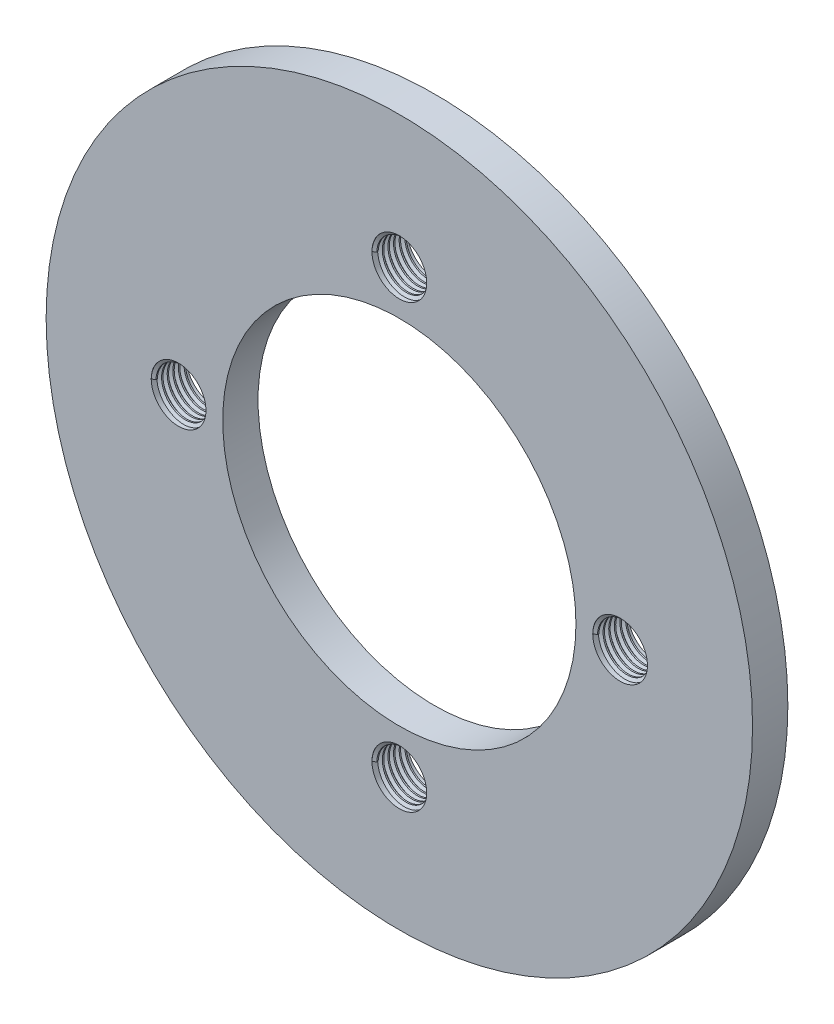
from build123d import *
from build123d.topology import SkipClean

# Parameters (mm, degrees)
SKETCH_1_R          = 20
SKETCH_1_R_2        = 10
EXTRUDE_1_DEPTH     = 2
SKETCH_2_R          = 1.55
CUT_EXTRUDE_1_DEPTH = 29.354893758
THREAD_1_PITCH      = 0.3175
THREAD_2_PITCH      = 0.3175
THREAD_3_PITCH      = 0.3175
THREAD_4_PITCH      = 0.3175


with BuildPart() as part:
    # Sketch 1 → 凸台-拉伸1 (new body)
    with BuildSketch(Plane.XY):
        Circle(SKETCH_1_R)
        Circle(SKETCH_1_R_2, mode=Mode.SUBTRACT)
    extrude(amount=EXTRUDE_1_DEPTH)

    # Sketch 2 → 切除-拉伸1 (cut, through all)
    with BuildSketch(Plane.XY.offset(2)):
        with Locations((0, 12.5)):
            Circle(SKETCH_2_R)
        with Locations((12.5, 0)):
            Circle(SKETCH_2_R)
        with Locations((0, -12.5)):
            Circle(SKETCH_2_R)
        with Locations((-12.5, 0)):
            Circle(SKETCH_2_R)
    extrude(amount=-CUT_EXTRUDE_1_DEPTH, mode=Mode.SUBTRACT)

    # 螺纹线1: arcs per turn and ends read off the stored shape
    # 螺纹线1: the profile of Sketch 1 2 profile screwed along a right-hand helix through 5.669291 turns, 6 arcs to a turn; built about Z, then put on its axis
    with SkipClean():  # the faces are left unmerged after this step: merging them gives an invalid solid
        thread_1_z = Axis((0, 0, 0), (0, 0, 1))
        thread_1_corners = [(1.5503, 0, -0.000173205), (1.5503, 0, 0.277985704), (1.378148085, 0, 0.17859375), (1.378148085, 0, 0.09921875)]
        with BuildLine(mode=Mode.PRIVATE) as thread_1_profile:
            Line(thread_1_corners[0], thread_1_corners[1])
            Line(thread_1_corners[1], thread_1_corners[2])
            Line(thread_1_corners[2], thread_1_corners[3])
            Line(thread_1_corners[3], thread_1_corners[0])
        thread_1_cap = Face(thread_1_profile.wire())
        thread_1_turn_angles = [0, 30, 60, 90, 120, 150, 180, 210, 240, 270, 300, 330, 360]
        thread_1_turn_weights = [1, 0.8660254037844387, 1, 0.8660254037844387, 1, 0.8660254037844387, 1, 0.8660254037844387, 1, 0.8660254037844387, 1, 0.8660254037844387, 1]
        thread_1_turn_rails = [Edge.make_bspline([Vector(p[0], p[1], 0).rotate(thread_1_z, thread_1_turn_angles[k]) / thread_1_turn_weights[k] + Vector(0, 0, p[2] + THREAD_1_PITCH * thread_1_turn_angles[k] / 360) for k in range(13)], [0, 0, 0, 1, 1, 2, 2, 3, 3, 4, 4, 5, 5, 6, 6, 6], 2, thread_1_turn_weights) for p in thread_1_corners]
        thread_1_turn_sides = [Face.make_surface_from_curves(thread_1_turn_rails[p[0]], thread_1_turn_rails[p[1]]) for p in [(0, 1), (1, 2), (2, 3), (3, 0)]]
        thread_1_last_angles = [1800, 1830, 1860, 1890, 1920, 1950, 1980, 2010, 2040, 2040.472440945, 2040.94488189]
        thread_1_last_weights = [1, 0.8660254037844387, 1, 0.8660254037844387, 1, 0.8660254037844387, 1, 0.8660254037844387, 1, 0.9999660048205748, 1]
        thread_1_last_rails = [Edge.make_bspline([Vector(p[0], p[1], 0).rotate(thread_1_z, thread_1_last_angles[k]) / thread_1_last_weights[k] + Vector(0, 0, p[2] + THREAD_1_PITCH * thread_1_last_angles[k] / 360) for k in range(11)], [0, 0, 0, 1, 1, 2, 2, 3, 3, 4, 4, 5, 5, 5], 2, thread_1_last_weights) for p in thread_1_corners]
        thread_1_last_sides = [Face.make_surface_from_curves(thread_1_last_rails[p[0]], thread_1_last_rails[p[1]]) for p in [(0, 1), (1, 2), (2, 3), (3, 0)]]
        thread_1 = Plane(origin=(0, 12.5, 2), x_dir=(-1, 0, 0), z_dir=(0, 0, -1)) * Solid(Shell([*[p.moved(Location((0, 0, THREAD_1_PITCH * i))) for i in range(5) for p in thread_1_turn_sides], *thread_1_last_sides, thread_1_cap, thread_1_cap.rotate(thread_1_z, 2040.94488189).moved(Location((0, 0, THREAD_1_PITCH * 2040.94488189 / 360)))]))
        add(thread_1)

    # 螺纹线2: arcs per turn and ends read off the stored shape
    # 螺纹线2: the profile of Sketch 2 2 profile screwed along a right-hand helix through 5.669291 turns, 6 arcs to a turn; built about Z, then put on its axis
    with SkipClean():  # the faces are left unmerged after this step: merging them gives an invalid solid
        thread_2_z = Axis((0, 0, 0), (0, 0, 1))
        thread_2_corners = [(1.5503, 0, -0.000173205), (1.5503, 0, 0.277985704), (1.378148085, 0, 0.17859375), (1.378148085, 0, 0.09921875)]
        with BuildLine(mode=Mode.PRIVATE) as thread_2_profile:
            Line(thread_2_corners[0], thread_2_corners[1])
            Line(thread_2_corners[1], thread_2_corners[2])
            Line(thread_2_corners[2], thread_2_corners[3])
            Line(thread_2_corners[3], thread_2_corners[0])
        thread_2_cap = Face(thread_2_profile.wire())
        thread_2_turn_angles = [0, 30, 60, 90, 120, 150, 180, 210, 240, 270, 300, 330, 360]
        thread_2_turn_weights = [1, 0.8660254037844387, 1, 0.8660254037844387, 1, 0.8660254037844387, 1, 0.8660254037844387, 1, 0.8660254037844387, 1, 0.8660254037844387, 1]
        thread_2_turn_rails = [Edge.make_bspline([Vector(p[0], p[1], 0).rotate(thread_2_z, thread_2_turn_angles[k]) / thread_2_turn_weights[k] + Vector(0, 0, p[2] + THREAD_2_PITCH * thread_2_turn_angles[k] / 360) for k in range(13)], [0, 0, 0, 1, 1, 2, 2, 3, 3, 4, 4, 5, 5, 6, 6, 6], 2, thread_2_turn_weights) for p in thread_2_corners]
        thread_2_turn_sides = [Face.make_surface_from_curves(thread_2_turn_rails[p[0]], thread_2_turn_rails[p[1]]) for p in [(0, 1), (1, 2), (2, 3), (3, 0)]]
        thread_2_last_angles = [1800, 1830, 1860, 1890, 1920, 1950, 1980, 2010, 2040, 2040.472440945, 2040.94488189]
        thread_2_last_weights = [1, 0.8660254037844387, 1, 0.8660254037844387, 1, 0.8660254037844387, 1, 0.8660254037844387, 1, 0.9999660048205748, 1]
        thread_2_last_rails = [Edge.make_bspline([Vector(p[0], p[1], 0).rotate(thread_2_z, thread_2_last_angles[k]) / thread_2_last_weights[k] + Vector(0, 0, p[2] + THREAD_2_PITCH * thread_2_last_angles[k] / 360) for k in range(11)], [0, 0, 0, 1, 1, 2, 2, 3, 3, 4, 4, 5, 5, 5], 2, thread_2_last_weights) for p in thread_2_corners]
        thread_2_last_sides = [Face.make_surface_from_curves(thread_2_last_rails[p[0]], thread_2_last_rails[p[1]]) for p in [(0, 1), (1, 2), (2, 3), (3, 0)]]
        thread_2 = Plane(origin=(12.5, 0, 2), x_dir=(-1, 0, 0), z_dir=(0, 0, -1)) * Solid(Shell([*[p.moved(Location((0, 0, THREAD_2_PITCH * i))) for i in range(5) for p in thread_2_turn_sides], *thread_2_last_sides, thread_2_cap, thread_2_cap.rotate(thread_2_z, 2040.94488189).moved(Location((0, 0, THREAD_2_PITCH * 2040.94488189 / 360)))]))
        add(thread_2)

    # 螺纹线3: arcs per turn and ends read off the stored shape
    # 螺纹线3: the profile of 螺纹线轮廓3 profile screwed along a right-hand helix through 5.669291 turns, 6 arcs to a turn; built about Z, then put on its axis
    with SkipClean():  # the faces are left unmerged after this step: merging them gives an invalid solid
        thread_3_z = Axis((0, 0, 0), (0, 0, 1))
        thread_3_corners = [(1.5503, 0, -0.000173205), (1.5503, 0, 0.277985704), (1.378148085, 0, 0.17859375), (1.378148085, 0, 0.09921875)]
        with BuildLine(mode=Mode.PRIVATE) as thread_3_profile:
            Line(thread_3_corners[0], thread_3_corners[1])
            Line(thread_3_corners[1], thread_3_corners[2])
            Line(thread_3_corners[2], thread_3_corners[3])
            Line(thread_3_corners[3], thread_3_corners[0])
        thread_3_cap = Face(thread_3_profile.wire())
        thread_3_turn_angles = [0, 30, 60, 90, 120, 150, 180, 210, 240, 270, 300, 330, 360]
        thread_3_turn_weights = [1, 0.8660254037844387, 1, 0.8660254037844387, 1, 0.8660254037844387, 1, 0.8660254037844387, 1, 0.8660254037844387, 1, 0.8660254037844387, 1]
        thread_3_turn_rails = [Edge.make_bspline([Vector(p[0], p[1], 0).rotate(thread_3_z, thread_3_turn_angles[k]) / thread_3_turn_weights[k] + Vector(0, 0, p[2] + THREAD_3_PITCH * thread_3_turn_angles[k] / 360) for k in range(13)], [0, 0, 0, 1, 1, 2, 2, 3, 3, 4, 4, 5, 5, 6, 6, 6], 2, thread_3_turn_weights) for p in thread_3_corners]
        thread_3_turn_sides = [Face.make_surface_from_curves(thread_3_turn_rails[p[0]], thread_3_turn_rails[p[1]]) for p in [(0, 1), (1, 2), (2, 3), (3, 0)]]
        thread_3_last_angles = [1800, 1830, 1860, 1890, 1920, 1950, 1980, 2010, 2040, 2040.472440945, 2040.94488189]
        thread_3_last_weights = [1, 0.8660254037844387, 1, 0.8660254037844387, 1, 0.8660254037844387, 1, 0.8660254037844387, 1, 0.9999660048205748, 1]
        thread_3_last_rails = [Edge.make_bspline([Vector(p[0], p[1], 0).rotate(thread_3_z, thread_3_last_angles[k]) / thread_3_last_weights[k] + Vector(0, 0, p[2] + THREAD_3_PITCH * thread_3_last_angles[k] / 360) for k in range(11)], [0, 0, 0, 1, 1, 2, 2, 3, 3, 4, 4, 5, 5, 5], 2, thread_3_last_weights) for p in thread_3_corners]
        thread_3_last_sides = [Face.make_surface_from_curves(thread_3_last_rails[p[0]], thread_3_last_rails[p[1]]) for p in [(0, 1), (1, 2), (2, 3), (3, 0)]]
        thread_3 = Plane(origin=(0, -12.5, 2), x_dir=(-1, 0, 0), z_dir=(0, 0, -1)) * Solid(Shell([*[p.moved(Location((0, 0, THREAD_3_PITCH * i))) for i in range(5) for p in thread_3_turn_sides], *thread_3_last_sides, thread_3_cap, thread_3_cap.rotate(thread_3_z, 2040.94488189).moved(Location((0, 0, THREAD_3_PITCH * 2040.94488189 / 360)))]))
        add(thread_3)

    # 螺纹线4: arcs per turn and ends read off the stored shape
    # 螺纹线4: the profile of 螺纹线轮廓4 profile screwed along a right-hand helix through 5.669291 turns, 6 arcs to a turn; built about Z, then put on its axis
    with SkipClean():  # the faces are left unmerged after this step: merging them gives an invalid solid
        thread_4_z = Axis((0, 0, 0), (0, 0, 1))
        thread_4_corners = [(1.5503, 0, -0.000173205), (1.5503, 0, 0.277985704), (1.378148085, 0, 0.17859375), (1.378148085, 0, 0.09921875)]
        with BuildLine(mode=Mode.PRIVATE) as thread_4_profile:
            Line(thread_4_corners[0], thread_4_corners[1])
            Line(thread_4_corners[1], thread_4_corners[2])
            Line(thread_4_corners[2], thread_4_corners[3])
            Line(thread_4_corners[3], thread_4_corners[0])
        thread_4_cap = Face(thread_4_profile.wire())
        thread_4_turn_angles = [0, 30, 60, 90, 120, 150, 180, 210, 240, 270, 300, 330, 360]
        thread_4_turn_weights = [1, 0.8660254037844387, 1, 0.8660254037844387, 1, 0.8660254037844387, 1, 0.8660254037844387, 1, 0.8660254037844387, 1, 0.8660254037844387, 1]
        thread_4_turn_rails = [Edge.make_bspline([Vector(p[0], p[1], 0).rotate(thread_4_z, thread_4_turn_angles[k]) / thread_4_turn_weights[k] + Vector(0, 0, p[2] + THREAD_4_PITCH * thread_4_turn_angles[k] / 360) for k in range(13)], [0, 0, 0, 1, 1, 2, 2, 3, 3, 4, 4, 5, 5, 6, 6, 6], 2, thread_4_turn_weights) for p in thread_4_corners]
        thread_4_turn_sides = [Face.make_surface_from_curves(thread_4_turn_rails[p[0]], thread_4_turn_rails[p[1]]) for p in [(0, 1), (1, 2), (2, 3), (3, 0)]]
        thread_4_last_angles = [1800, 1830, 1860, 1890, 1920, 1950, 1980, 2010, 2040, 2040.472440945, 2040.94488189]
        thread_4_last_weights = [1, 0.8660254037844387, 1, 0.8660254037844387, 1, 0.8660254037844387, 1, 0.8660254037844387, 1, 0.9999660048205748, 1]
        thread_4_last_rails = [Edge.make_bspline([Vector(p[0], p[1], 0).rotate(thread_4_z, thread_4_last_angles[k]) / thread_4_last_weights[k] + Vector(0, 0, p[2] + THREAD_4_PITCH * thread_4_last_angles[k] / 360) for k in range(11)], [0, 0, 0, 1, 1, 2, 2, 3, 3, 4, 4, 5, 5, 5], 2, thread_4_last_weights) for p in thread_4_corners]
        thread_4_last_sides = [Face.make_surface_from_curves(thread_4_last_rails[p[0]], thread_4_last_rails[p[1]]) for p in [(0, 1), (1, 2), (2, 3), (3, 0)]]
        thread_4 = Plane(origin=(-12.5, 0, 2), x_dir=(-1, 0, 0), z_dir=(0, 0, -1)) * Solid(Shell([*[p.moved(Location((0, 0, THREAD_4_PITCH * i))) for i in range(5) for p in thread_4_turn_sides], *thread_4_last_sides, thread_4_cap, thread_4_cap.rotate(thread_4_z, 2040.94488189).moved(Location((0, 0, THREAD_4_PITCH * 2040.94488189 / 360)))]))
        add(thread_4)


solid = part.part
